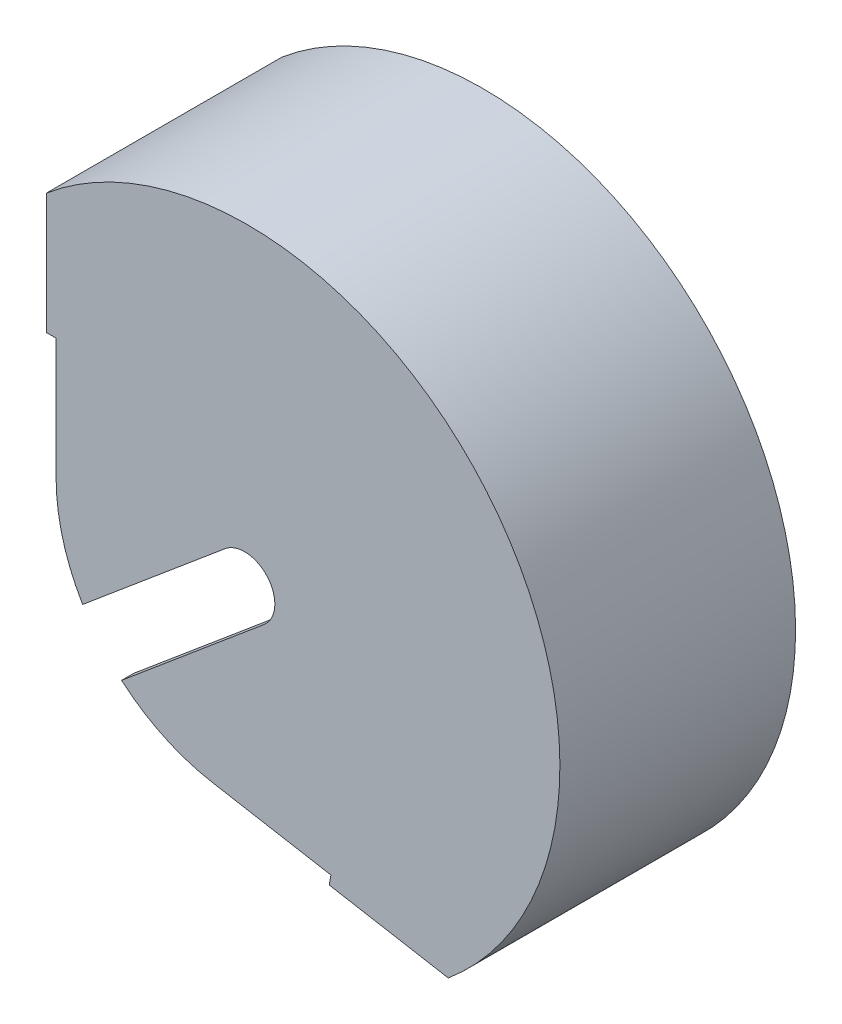
from build123d import *

# Parameters (mm, degrees)
SIDE_DEPTH          = 2.54
COVER_DEPTH         = 44.45
FLYWHEEL_SLIT_REACH = 107.934
MOUNT_HOLES_REACH   = 107.934
SKETCH4_R           = 3.2639


with BuildPart() as part:
    # Sketch1 → Side (new body)
    with BuildSketch(Plane.XY):
        with BuildLine():
            ThreePointArc((-39.624, 0), (-30.353745014, -25.469816246), (-6.880635392, -39.022022405))
            Line((-6.880635392, -39.022022405), (18.133481535, -43.432686118))
            Line((18.133481535, -43.432686118), (17.780628438, -45.433815472))
            Line((17.780628438, -45.433815472), (42.794745364, -49.844479185))
            ThreePointArc((42.794745364, -49.844479185), (50.891612275, 42.70313309), (-41.656, 50.8))
            Line((-41.656, 50.8), (-41.656, 25.4))
            Line((-41.656, 25.4), (-39.624, 25.4))
            Line((-39.624, 25.4), (-39.624, 0))
        make_face()
    side = extrude(amount=SIDE_DEPTH)

    # Sketch2 → Cover (add)
    with BuildSketch(Plane.XY.offset(2.54)):
        with BuildLine():
            Line((-41.656, 48.854247114), (-40.023319471, 48.854247114))
            ThreePointArc((-40.023319471, 48.854247114), (48.945859389, 41.070452561), (41.162064836, -47.898726299))
            Line((41.162064836, -47.898726299), (40.878552837, -49.506602742))
            Line((40.878552837, -49.506602742), (42.794745364, -49.844479185))
            ThreePointArc((42.794745364, -49.844479185), (50.891612275, 42.70313309), (-41.656, 50.8))
            Line((-41.656, 50.8), (-41.656, 48.854247114))
        make_face()
    extrude(amount=COVER_DEPTH)

    # Mirror1: Side across plane
    add(side.mirror(Plane.XY.offset(24.765)))

    # Sketch3 → Flywheel slit (cut, up to next)
    with BuildSketch(Plane.XY.offset(49.53), mode=Mode.PRIVATE) as flywheel_slit_sk1:
        with BuildLine():
            Line((-4.081701322, 4.864382214), (-37.159500375, -22.891186772))
            Line((-37.159500375, -22.891186772), (-28.996097732, -32.6199512))
            Line((-28.996097732, -32.6199512), (4.081701322, -4.864382214))
            ThreePointArc((4.081701322, -4.864382214), (4.864382214, 4.081701322), (-4.081701322, 4.864382214))
        make_face()
    flywheel_slit_tool1 = extrude(flywheel_slit_sk1.sketch, amount=-FLYWHEEL_SLIT_REACH, mode=Mode.PRIVATE) & part.part
    add(flywheel_slit_tool1.solids().sort_by_distance((-14.612688, -12.261501, 49.53))[0], mode=Mode.SUBTRACT)

    # Sketch4 → Mount holes (cut, up to next)
    with BuildSketch(Plane(origin=(0, 0, 0), x_dir=(-1, 0, 0), z_dir=(0, 0, -1)), mode=Mode.PRIVATE) as mount_holes_sk1:
        with Locations((-2.116217682, -33.531680079)):
            Circle(SKETCH4_R)
    mount_holes_tool1 = extrude(mount_holes_sk1.sketch, amount=-MOUNT_HOLES_REACH, mode=Mode.PRIVATE) & part.part
    # Sketch4 → Mount holes (cut, up to next)
    with BuildSketch(Plane(origin=(0, 0, 0), x_dir=(-1, 0, 0), z_dir=(0, 0, -1)), mode=Mode.PRIVATE) as mount_holes_sk2:
        with Locations((33.277492898, 10.173950581)):
            Circle(SKETCH4_R)
    mount_holes_tool2 = extrude(mount_holes_sk2.sketch, amount=-MOUNT_HOLES_REACH, mode=Mode.PRIVATE) & part.part
    add(mount_holes_tool1.solids().sort_by_distance((2.116218, -33.53168, 0))[0], mode=Mode.SUBTRACT)
    add(mount_holes_tool2.solids().sort_by_distance((-33.277493, 10.173951, 0))[0], mode=Mode.SUBTRACT)


solid = part.part
